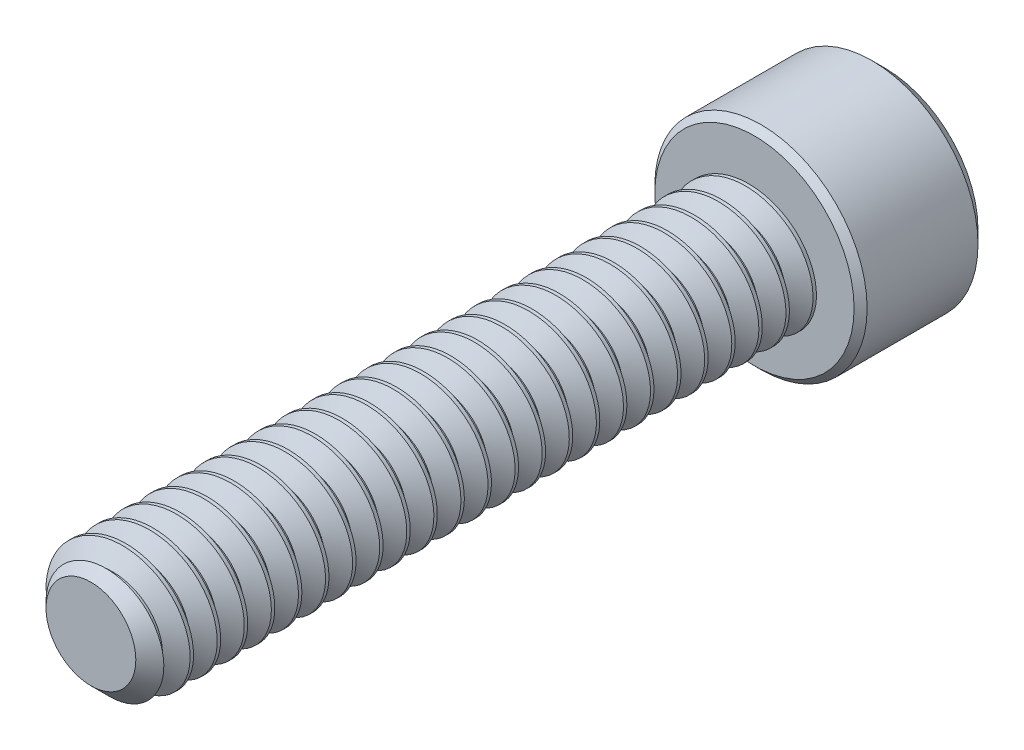
from build123d import *

# Parameters (mm, degrees)
SKETCH1_R          = 1.0922
EXTRUDE1_DEPTH     = 11.1125
CHAMFER3_SIZE      = 0.340178571
CUT_SWEEP1_PITCH   = 0.453571429
SKETCH6_R          = 1.778
EXTRUDE2_DEPTH     = 2.1844
CUT_EXTRUDE1_DEPTH = 1.48828125
SKETCH8_R          = 1.14567944
CUT_EXTRUDE2_DEPTH = 0.21844
CUT_EXTRUDE2_DRAFT = -45
CHAMFER1_SIZE      = 0.21844
CHAMFER2_SIZE      = 0.10922


with BuildPart() as part:
    # Sketch1 → Extrude1 (new body)
    with BuildSketch(Plane.XY):
        Circle(SKETCH1_R)
    extrude(amount=-EXTRUDE1_DEPTH)

    # Chamfer3
    chamfer3_edges = [part.edges().sort_by_distance(p)[0] for p in [
        (-1.0922, 0, 0),
    ]]
    chamfer(chamfer3_edges, length=CHAMFER3_SIZE)

    # Cut-Sweep1: arcs per turn and ends read off the stored shape
    # Cut-Sweep1: the profile of Sketch3 profile screwed along a right-hand helix through 26 turns, 6 arcs to a turn; built about Z, then put on its axis
    cut_sweep1_z = Axis((0, 0, 0), (0, 0, 1))
    cut_sweep1_corners = [(1.0925, 0, -0.397048205), (0.797596715, 0, -0.226785714), (0.797596715, 0, -0.170089286), (1.0925, 0, 0.000173205)]
    with BuildLine(mode=Mode.PRIVATE) as cut_sweep1_profile:
        Line(cut_sweep1_corners[0], cut_sweep1_corners[1])
        Line(cut_sweep1_corners[1], cut_sweep1_corners[2])
        Line(cut_sweep1_corners[2], cut_sweep1_corners[3])
        Line(cut_sweep1_corners[3], cut_sweep1_corners[0])
    cut_sweep1_cap = Face(cut_sweep1_profile.wire())
    cut_sweep1_turn_angles = [0, 30, 60, 90, 120, 150, 180, 210, 240, 270, 300, 330, 360]
    cut_sweep1_turn_weights = [1, 0.8660254037844387, 1, 0.8660254037844387, 1, 0.8660254037844387, 1, 0.8660254037844387, 1, 0.8660254037844387, 1, 0.8660254037844387, 1]
    cut_sweep1_turn_rails = [Edge.make_bspline([Vector(p[0], p[1], 0).rotate(cut_sweep1_z, cut_sweep1_turn_angles[k]) / cut_sweep1_turn_weights[k] + Vector(0, 0, p[2] + CUT_SWEEP1_PITCH * cut_sweep1_turn_angles[k] / 360) for k in range(13)], [0, 0, 0, 1, 1, 2, 2, 3, 3, 4, 4, 5, 5, 6, 6, 6], 2, cut_sweep1_turn_weights) for p in cut_sweep1_corners]
    cut_sweep1_turn_sides = [Face.make_surface_from_curves(cut_sweep1_turn_rails[p[0]], cut_sweep1_turn_rails[p[1]]) for p in [(0, 1), (1, 2), (2, 3), (3, 0)]]
    cut_sweep1 = Plane(origin=(0, 0, 0), x_dir=(0, 1, 0), z_dir=(0, 0, -1)) * Solid(Shell([*[p.moved(Location((0, 0, CUT_SWEEP1_PITCH * i))) for i in range(26) for p in cut_sweep1_turn_sides], cut_sweep1_cap, cut_sweep1_cap.rotate(cut_sweep1_z, 9360).moved(Location((0, 0, CUT_SWEEP1_PITCH * 9360 / 360)))]))
    add(cut_sweep1, mode=Mode.SUBTRACT)

    # Sketch6 → Extrude2 (add)
    with BuildSketch(Plane(origin=(0, 0, -11.1125), x_dir=(-1, 0, 0), z_dir=(0, 0, -1))):
        Circle(SKETCH6_R)
    extrude(amount=EXTRUDE2_DEPTH)

    # Sketch7 → Cut-Extrude1 (cut)
    with BuildSketch(Plane(origin=(0, 0, -13.2969), x_dir=(-1, 0, 0), z_dir=(0, 0, -1))):
        Polygon((0, 1.14567944), (-0.9921875, 0.57283972), (-0.9921875, -0.57283972), (0, -1.14567944), (0.9921875, -0.57283972), (0.9921875, 0.57283972), align=None)
    extrude(amount=-CUT_EXTRUDE1_DEPTH, mode=Mode.SUBTRACT)


with BuildPart() as cut_extrude2_tool:
    # Sketch8 → Cut-Extrude2 (with draft: the straight prism first)
    with BuildSketch(Plane(origin=(0, 0, -13.2969), x_dir=(-1, 0, 0), z_dir=(0, 0, -1))):
        Circle(SKETCH8_R)
    extrude(amount=-CUT_EXTRUDE2_DEPTH)
    # Cut-Extrude2: the draft: its side faces are tilted about the plane it starts from
    cut_extrude2_sides = [cut_extrude2_tool.faces().sort_by_distance(p)[0] for p in [
        (1.14567944, 0, -13.18768),
    ]]
    draft(cut_extrude2_sides, Plane(origin=(0, 0, -13.2969), x_dir=(-1, 0, 0), z_dir=(0, 0, -1)), CUT_EXTRUDE2_DRAFT)


with BuildPart() as part_1:
    add(part.part)

    # Cut-Extrude2: cut by cut_extrude2_tool
    add(cut_extrude2_tool.part, mode=Mode.SUBTRACT)

    # Chamfer1
    chamfer1_edges = [part_1.edges().sort_by_distance(p)[0] for p in [
        (1.778, 0, -13.2969),
    ]]
    chamfer(chamfer1_edges, length=CHAMFER1_SIZE)

    # Chamfer2
    chamfer2_edges = [part_1.edges().sort_by_distance(p)[0] for p in [
        (1.778, 0, -11.1125),
    ]]
    chamfer(chamfer2_edges, length=CHAMFER2_SIZE)


solid = part_1.part
